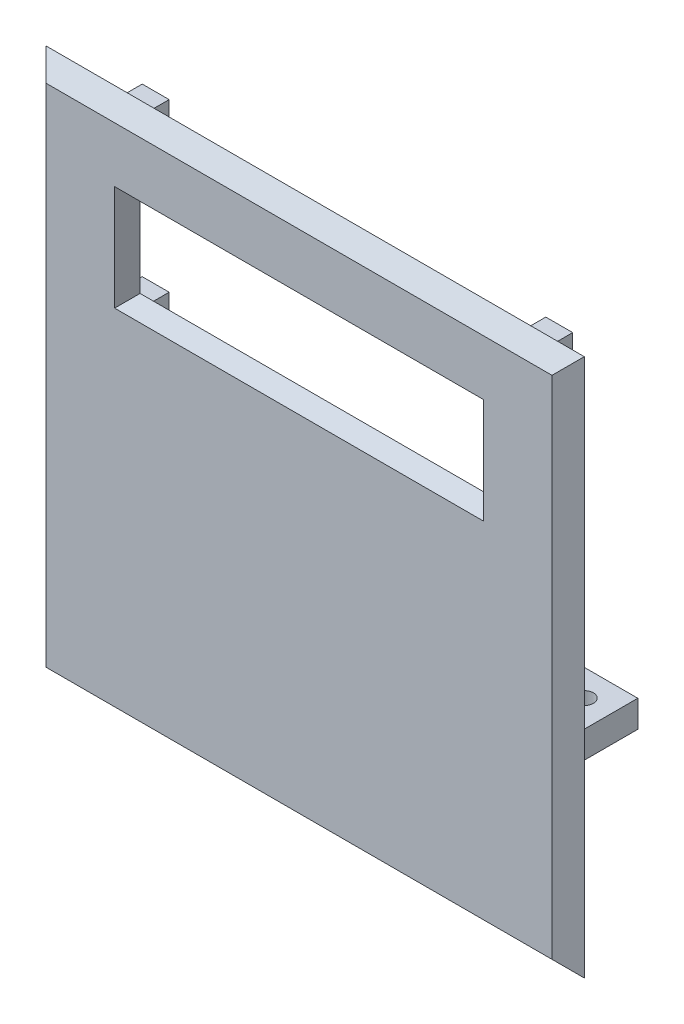
from build123d import *
from OCP.BRepFilletAPI import BRepFilletAPI_MakeChamfer

# Parameters (mm, degrees)
ESQUISSE1_W             = 100
ESQUISSE1_H             = 100
BOSS_EXTRU_1_DEPTH      = 3
ESQUISSE2_W             = 65.1
ESQUISSE2_H             = 16.1
ENL_V_MAT_EXTRU_1_DEPTH = 142.453172464
CHANFREIN1_SIZE         = 3
ESQUISSE3_W             = 5
ESQUISSE3_H             = 5
ESQUISSE3_R             = 1.3
BOSS_EXTRU_2_DEPTH      = 7.85
CHANFREIN2_SIZE         = 1.732050808
CHANFREIN2_SIZE_2       = 3
CONG_1_R                = 1
ESQUISSE4_W             = 10
ESQUISSE4_H             = 5
BOSS_EXTRU_3_DEPTH      = 10
ESQUISSE5_R             = 1.7
ENL_V_MAT_EXTRU_2_DEPTH = 10


with BuildPart() as part:
    # Esquisse1 → Boss.-Extru.1 (new body)
    with BuildSketch(Plane.XY):
        with Locations((50, 50)):
            Rectangle(ESQUISSE1_W, ESQUISSE1_H)
    extrude(amount=BOSS_EXTRU_1_DEPTH)

    # Esquisse2 → Enlèv. mat.-Extru.1 (cut, through all)
    with BuildSketch(Plane.XY.offset(3)):
        with Locations((50, 76.95)):
            Rectangle(ESQUISSE2_W, ESQUISSE2_H)
    extrude(amount=-ENL_V_MAT_EXTRU_1_DEPTH, mode=Mode.SUBTRACT)

    # Chanfrein1
    chanfrein1_edges = [part.edges().sort_by_distance(p)[0] for p in [
        (50, 0, 3),
        (0, 50, 3),
        (50, 100, 3),
        (100, 50, 3),
    ]]
    chamfer(chanfrein1_edges, length=CHANFREIN1_SIZE - 0.0001)  # a hair under: the kernel refuses the full size

    # Esquisse3 → Boss.-Extru.2 (add)
    # profile 1 of 4: a face of its own
    with BuildSketch(Plane(origin=(0, 0, 0), x_dir=(-1, 0, 0), z_dir=(0, 0, -1))):
        with Locations((-87.5, 92.45)):
            Rectangle(ESQUISSE3_W, ESQUISSE3_H)
        with Locations((-87.5, 92.45)):
            Circle(ESQUISSE3_R, mode=Mode.SUBTRACT)
    # profile 2 of 4: a face of its own
    with BuildSketch(Plane(origin=(0, 0, 0), x_dir=(-1, 0, 0), z_dir=(0, 0, -1))):
        with Locations((-12.5, 92.45)):
            Rectangle(ESQUISSE3_W, ESQUISSE3_H)
        with Locations((-12.5, 92.45)):
            Circle(ESQUISSE3_R, mode=Mode.SUBTRACT)
    # profile 3 of 4: a face of its own
    with BuildSketch(Plane(origin=(0, 0, 0), x_dir=(-1, 0, 0), z_dir=(0, 0, -1))):
        with Locations((-87.5, 61.45)):
            Rectangle(ESQUISSE3_W, ESQUISSE3_H)
        with Locations((-87.5, 61.45)):
            Circle(ESQUISSE3_R, mode=Mode.SUBTRACT)
    # profile 4 of 4: a face of its own
    with BuildSketch(Plane(origin=(0, 0, 0), x_dir=(-1, 0, 0), z_dir=(0, 0, -1))):
        with Locations((-12.5, 61.45)):
            Rectangle(ESQUISSE3_W, ESQUISSE3_H)
        with Locations((-12.5, 61.45)):
            Circle(ESQUISSE3_R, mode=Mode.SUBTRACT)
    extrude(amount=BOSS_EXTRU_2_DEPTH)

    # Chanfrein2
    chanfrein2_edges_1 = [part.edges().sort_by_distance(p)[0] for p in [
        (82.55, 76.95, 3),
    ]]
    chanfrein2_side_1 = [part.faces().sort_by_distance(p)[0] for p in [
        (82.584641016, 76.95, 3),
    ]]
    chanfrein2_edges_2 = [part.edges().sort_by_distance(p)[0] for p in [
        (50, 68.9, 3),
    ]]
    chanfrein2_side_2 = [part.faces().sort_by_distance(p)[0] for p in [
        (50, 68.865358984, 3),
    ]]
    chanfrein2_edges_3 = [part.edges().sort_by_distance(p)[0] for p in [
        (17.45, 76.95, 3),
    ]]
    chanfrein2_side_3 = [part.faces().sort_by_distance(p)[0] for p in [
        (17.415358984, 76.95, 3),
    ]]
    chanfrein2_edges_4 = [part.edges().sort_by_distance(p)[0] for p in [
        (50, 85, 3),
    ]]
    chanfrein2_side_4 = [part.faces().sort_by_distance(p)[0] for p in [
        (50, 85.034641016, 3),
    ]]
    chanfrein2 = BRepFilletAPI_MakeChamfer(part.part.solid().wrapped)
    for e in chanfrein2_edges_1:
        chanfrein2.Add(CHANFREIN2_SIZE - 0.0001, CHANFREIN2_SIZE_2 - 0.0001, e.wrapped, chanfrein2_side_1[0].wrapped)
    for e in chanfrein2_edges_2:
        chanfrein2.Add(CHANFREIN2_SIZE - 0.0001, CHANFREIN2_SIZE_2 - 0.0001, e.wrapped, chanfrein2_side_2[0].wrapped)
    for e in chanfrein2_edges_3:
        chanfrein2.Add(CHANFREIN2_SIZE - 0.0001, CHANFREIN2_SIZE_2 - 0.0001, e.wrapped, chanfrein2_side_3[0].wrapped)
    for e in chanfrein2_edges_4:
        chanfrein2.Add(CHANFREIN2_SIZE - 0.0001, CHANFREIN2_SIZE_2 - 0.0001, e.wrapped, chanfrein2_side_4[0].wrapped)
    add(Compound.cast(chanfrein2.Shape()), mode=Mode.REPLACE)  # a hair under: the kernel refuses the full size

    # Congé1
    cong_1_edges = [part.edges().sort_by_distance(p)[0] for p in [
        (90, 92.45, 0),
        (87.5, 89.95, 0),
        (85, 92.45, 0),
        (87.5, 94.95, 0),
        (15, 92.45, 0),
        (12.5, 89.95, 0),
        (10, 92.45, 0),
        (12.5, 94.95, 0),
        (90, 61.45, 0),
        (87.5, 58.95, 0),
        (85, 61.45, 0),
        (87.5, 63.95, 0),
        (15, 61.45, 0),
        (12.5, 58.95, 0),
        (10, 61.45, 0),
        (12.5, 63.95, 0),
    ]]
    fillet(cong_1_edges, radius=CONG_1_R)

    # Esquisse4 → Boss.-Extru.3 (add)
    with BuildSketch(Plane(origin=(0, 0, 0), x_dir=(-1, 0, 0), z_dir=(0, 0, -1))):
        with Locations((-94.95, 37.5)):
            Rectangle(ESQUISSE4_W, ESQUISSE4_H)
        with Locations((-5.05, 37.5)):
            Rectangle(ESQUISSE4_W, ESQUISSE4_H)
    extrude(amount=BOSS_EXTRU_3_DEPTH)

    # Esquisse5 → Enlèv. mat.-Extru.2 (cut)
    with BuildSketch(Plane.XZ.offset(-35)):
        with Locations(Location((94.95, -5.05, 0), (0, 0, 270))):
            Circle(ESQUISSE5_R)
        with Locations(Location((5.05, -5.05, 0), (0, 0, 270))):
            Circle(ESQUISSE5_R)
    extrude(amount=-ENL_V_MAT_EXTRU_2_DEPTH, mode=Mode.SUBTRACT)


solid = part.part
